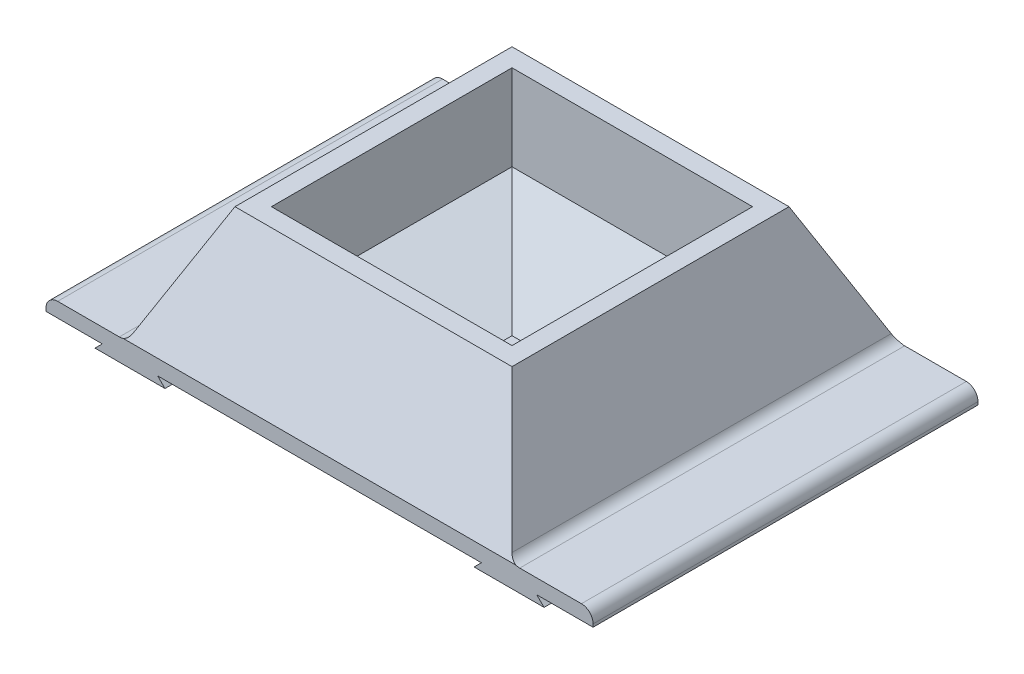
from build123d import *
from OCP.BRepFilletAPI import BRepFilletAPI_MakeChamfer

# Parameters (mm, degrees)
SKETCH1_W           = 238.252
SKETCH1_H           = 167.64
BOSS_EXTRUDE1_DEPTH = 6.35
SKETCH2_W           = 120.65
SKETCH2_H           = 120.65
SKETCH2_W_2         = 104.775
SKETCH2_H_2         = 104.775
BOSS_EXTRUDE2_DEPTH = 50.8
CHAMFER1_SIZE       = 23.622
CHAMFER1_SIZE_2     = 50.8
CHAMFER2_SIZE       = 13.462
CHAMFER2_SIZE2      = 50.240867971
BOSS_EXTRUDE3_DEPTH = 167.64
FILLET1_R           = 5.08


with BuildPart() as part:
    # Sketch1 → Boss-Extrude1 (new body)
    with BuildSketch(Plane(origin=(0, 0, 0), x_dir=(1, 0, 0), z_dir=(0, 1, 0))):
        Rectangle(SKETCH1_W, SKETCH1_H)
    extrude(amount=BOSS_EXTRUDE1_DEPTH)

    # Sketch2 → Boss-Extrude2 (add)
    with BuildSketch(Plane(origin=(0, 6.35, 0), x_dir=(1, 0, 0), z_dir=(0, 1, 0))):
        Rectangle(SKETCH2_W, SKETCH2_H)
        Rectangle(SKETCH2_W_2, SKETCH2_H_2, mode=Mode.SUBTRACT)
    extrude(amount=BOSS_EXTRUDE2_DEPTH)

    # Chamfer1
    # the kernel refuses this chamfer: 50.8, 23.622 mm, written as the material it adds along each edge
    with BuildSketch(Plane(origin=(60.325, 6.35, 60.325), x_dir=(0, -0.07505854445715336, 0.9971791287948087), z_dir=(-1, 0, 0))) as chamfer1_piece_1_section:
        Polygon((CHAMFER1_SIZE * 0.997179128795, CHAMFER1_SIZE * 0.0750585444572), (-CHAMFER1_SIZE_2 * 0.0750585444572, CHAMFER1_SIZE_2 * 0.997179128795), (0, 0), align=None)
    chamfer1_piece_1 = extrude(amount=120.65, mode=Mode.PRIVATE)
    chamfer1_piece_1 = split(chamfer1_piece_1, bisect_by=Plane(origin=(0, 23.458170977, 83.82), z_dir=(0, 0, -1)), keep=Keep.TOP, mode=Mode.PRIVATE)
    chamfer1_piece_1 = split(chamfer1_piece_1, bisect_by=Plane(origin=(0, 57.15, 67.75803998), z_dir=(0, -1, 0)), keep=Keep.TOP, mode=Mode.PRIVATE)
    add(chamfer1_piece_1)
    with BuildSketch(Plane(origin=(60.325, 6.35, -60.325), x_dir=(0.9971791287948087, -0.07505854445715335, 0), z_dir=(0, 0, 1))) as chamfer1_piece_2_section:
        Polygon((CHAMFER1_SIZE * 0.997179128795, CHAMFER1_SIZE * 0.0750585444572), (-CHAMFER1_SIZE_2 * 0.0750585444572, CHAMFER1_SIZE_2 * 0.997179128795), (0, 0), align=None)
    chamfer1_piece_2 = extrude(amount=120.65, mode=Mode.PRIVATE)
    chamfer1_piece_2 = split(chamfer1_piece_2, bisect_by=Plane(origin=(67.804180933, 57.15, 0), z_dir=(0, -1, 0)), keep=Keep.TOP, mode=Mode.PRIVATE)
    add(chamfer1_piece_2)
    with BuildSketch(Plane(origin=(-60.325, 6.35, 60.325), x_dir=(-0.9971791287948087, -0.07505854445715335, 0), z_dir=(0, 0, -1))) as chamfer1_piece_3_section:
        Polygon((CHAMFER1_SIZE * 0.997179128795, CHAMFER1_SIZE * 0.0750585444572), (-CHAMFER1_SIZE_2 * 0.0750585444572, CHAMFER1_SIZE_2 * 0.997179128795), (0, 0), align=None)
    chamfer1_piece_3 = extrude(amount=120.65, mode=Mode.PRIVATE)
    chamfer1_piece_3 = split(chamfer1_piece_3, bisect_by=Plane(origin=(-67.804180933, 57.15, 0), z_dir=(0, -1, 0)), keep=Keep.TOP, mode=Mode.PRIVATE)
    add(chamfer1_piece_3)
    with BuildSketch(Plane(origin=(-60.325, 6.35, -60.325), x_dir=(0, -0.07505854445715336, -0.9971791287948087), z_dir=(1, 0, 0))) as chamfer1_piece_4_section:
        Polygon((CHAMFER1_SIZE * 0.997179128795, CHAMFER1_SIZE * 0.0750585444572), (-CHAMFER1_SIZE_2 * 0.0750585444572, CHAMFER1_SIZE_2 * 0.997179128795), (0, 0), align=None)
    chamfer1_piece_4 = extrude(amount=120.65, mode=Mode.PRIVATE)
    chamfer1_piece_4 = split(chamfer1_piece_4, bisect_by=Plane(origin=(0, 23.458170977, -83.82), z_dir=(0, 0, 1)), keep=Keep.TOP, mode=Mode.PRIVATE)
    chamfer1_piece_4 = split(chamfer1_piece_4, bisect_by=Plane(origin=(0, 57.15, -67.75803998), z_dir=(0, -1, 0)), keep=Keep.TOP, mode=Mode.PRIVATE)
    add(chamfer1_piece_4)
    with BuildSketch(Plane(origin=(60.325, 6.35, -60.325), x_dir=(0.9971791287948087, -0.07505854445715335, 0), z_dir=(0, 0, 1))) as chamfer1_piece_5a_section:
        Polygon((CHAMFER1_SIZE * 0.997179128795, CHAMFER1_SIZE * 0.0750585444572), (-CHAMFER1_SIZE_2 * 0.0750585444572, CHAMFER1_SIZE_2 * 0.997179128795), (0, 0), align=None)
    chamfer1_piece_5a = extrude(amount=252.2737775, mode=Mode.PRIVATE)
    chamfer1_piece_5a = split(chamfer1_piece_5a, bisect_by=Plane(origin=(67.804180933, 23.405571351, 83.82), z_dir=(0, 0, -1)), keep=Keep.TOP, mode=Mode.PRIVATE)
    chamfer1_piece_5a = split(chamfer1_piece_5a, bisect_by=Plane(origin=(67.804180933, 23.405571351, 60.325), z_dir=(0, 0, 1)), keep=Keep.TOP, mode=Mode.PRIVATE)
    chamfer1_piece_5a = split(chamfer1_piece_5a, bisect_by=Plane(origin=(67.804180933, 57.15, 72.0725), z_dir=(0, -1, 0)), keep=Keep.TOP, mode=Mode.PRIVATE)
    with BuildSketch(Plane(origin=(191.9487775, 6.35, 60.325), x_dir=(0, -0.07505854445715336, 0.9971791287948087), z_dir=(-1, 0, 0))) as chamfer1_piece_5b_section:
        Polygon((CHAMFER1_SIZE * 0.997179128795, CHAMFER1_SIZE * 0.0750585444572), (-CHAMFER1_SIZE_2 * 0.0750585444572, CHAMFER1_SIZE_2 * 0.997179128795), (0, 0), align=None)
    chamfer1_piece_5b = extrude(amount=252.2737775, mode=Mode.PRIVATE)
    chamfer1_piece_5b = split(chamfer1_piece_5b, bisect_by=Plane(origin=(89.7255, 23.458170977, 83.82), z_dir=(0, 0, -1)), keep=Keep.TOP, mode=Mode.PRIVATE)
    chamfer1_piece_5b = split(chamfer1_piece_5b, bisect_by=Plane(origin=(119.126, 23.458170977, 67.75803998), z_dir=(-1, 0, 0)), keep=Keep.TOP, mode=Mode.PRIVATE)
    chamfer1_piece_5b = split(chamfer1_piece_5b, bisect_by=Plane(origin=(60.325, 23.458170977, 67.75803998), z_dir=(1, 0, 0)), keep=Keep.TOP, mode=Mode.PRIVATE)
    chamfer1_piece_5b = split(chamfer1_piece_5b, bisect_by=Plane(origin=(89.7255, 57.15, 67.75803998), z_dir=(0, -1, 0)), keep=Keep.TOP, mode=Mode.PRIVATE)
    chamfer1_piece_5 = chamfer1_piece_5a & chamfer1_piece_5b
    add(chamfer1_piece_5)
    with BuildSketch(Plane(origin=(-60.325, 6.35, 191.9487775), x_dir=(-0.9971791287948087, -0.07505854445715335, 0), z_dir=(0, 0, -1))) as chamfer1_piece_6a_section:
        Polygon((CHAMFER1_SIZE * 0.997179128795, CHAMFER1_SIZE * 0.0750585444572), (-CHAMFER1_SIZE_2 * 0.0750585444572, CHAMFER1_SIZE_2 * 0.997179128795), (0, 0), align=None)
    chamfer1_piece_6a = extrude(amount=252.2737775, mode=Mode.PRIVATE)
    chamfer1_piece_6a = split(chamfer1_piece_6a, bisect_by=Plane(origin=(-67.804180933, 23.405571351, 83.82), z_dir=(0, 0, -1)), keep=Keep.TOP, mode=Mode.PRIVATE)
    chamfer1_piece_6a = split(chamfer1_piece_6a, bisect_by=Plane(origin=(-67.804180933, 23.405571351, 60.325), z_dir=(0, 0, 1)), keep=Keep.TOP, mode=Mode.PRIVATE)
    chamfer1_piece_6a = split(chamfer1_piece_6a, bisect_by=Plane(origin=(-67.804180933, 57.15, 72.0725), z_dir=(0, -1, 0)), keep=Keep.TOP, mode=Mode.PRIVATE)
    with BuildSketch(Plane(origin=(60.325, 6.35, 60.325), x_dir=(0, -0.07505854445715336, 0.9971791287948087), z_dir=(-1, 0, 0))) as chamfer1_piece_6b_section:
        Polygon((CHAMFER1_SIZE * 0.997179128795, CHAMFER1_SIZE * 0.0750585444572), (-CHAMFER1_SIZE_2 * 0.0750585444572, CHAMFER1_SIZE_2 * 0.997179128795), (0, 0), align=None)
    chamfer1_piece_6b = extrude(amount=252.2737775, mode=Mode.PRIVATE)
    chamfer1_piece_6b = split(chamfer1_piece_6b, bisect_by=Plane(origin=(-89.7255, 23.458170977, 83.82), z_dir=(0, 0, -1)), keep=Keep.TOP, mode=Mode.PRIVATE)
    chamfer1_piece_6b = split(chamfer1_piece_6b, bisect_by=Plane(origin=(-119.126, 23.458170977, 67.75803998), z_dir=(1, 0, 0)), keep=Keep.TOP, mode=Mode.PRIVATE)
    chamfer1_piece_6b = split(chamfer1_piece_6b, bisect_by=Plane(origin=(-60.325, 23.458170977, 67.75803998), z_dir=(-1, 0, 0)), keep=Keep.TOP, mode=Mode.PRIVATE)
    chamfer1_piece_6b = split(chamfer1_piece_6b, bisect_by=Plane(origin=(-89.7255, 57.15, 67.75803998), z_dir=(0, -1, 0)), keep=Keep.TOP, mode=Mode.PRIVATE)
    chamfer1_piece_6 = chamfer1_piece_6a & chamfer1_piece_6b
    add(chamfer1_piece_6)
    with BuildSketch(Plane(origin=(60.325, 6.35, -191.9487775), x_dir=(0.9971791287948087, -0.07505854445715335, 0), z_dir=(0, 0, 1))) as chamfer1_piece_7a_section:
        Polygon((CHAMFER1_SIZE * 0.997179128795, CHAMFER1_SIZE * 0.0750585444572), (-CHAMFER1_SIZE_2 * 0.0750585444572, CHAMFER1_SIZE_2 * 0.997179128795), (0, 0), align=None)
    chamfer1_piece_7a = extrude(amount=252.2737775, mode=Mode.PRIVATE)
    chamfer1_piece_7a = split(chamfer1_piece_7a, bisect_by=Plane(origin=(67.804180933, 23.405571351, -83.82), z_dir=(0, 0, 1)), keep=Keep.TOP, mode=Mode.PRIVATE)
    chamfer1_piece_7a = split(chamfer1_piece_7a, bisect_by=Plane(origin=(67.804180933, 23.405571351, -60.325), z_dir=(0, 0, -1)), keep=Keep.TOP, mode=Mode.PRIVATE)
    chamfer1_piece_7a = split(chamfer1_piece_7a, bisect_by=Plane(origin=(67.804180933, 57.15, -72.0725), z_dir=(0, -1, 0)), keep=Keep.TOP, mode=Mode.PRIVATE)
    with BuildSketch(Plane(origin=(-60.325, 6.35, -60.325), x_dir=(0, -0.07505854445715336, -0.9971791287948087), z_dir=(1, 0, 0))) as chamfer1_piece_7b_section:
        Polygon((CHAMFER1_SIZE * 0.997179128795, CHAMFER1_SIZE * 0.0750585444572), (-CHAMFER1_SIZE_2 * 0.0750585444572, CHAMFER1_SIZE_2 * 0.997179128795), (0, 0), align=None)
    chamfer1_piece_7b = extrude(amount=252.2737775, mode=Mode.PRIVATE)
    chamfer1_piece_7b = split(chamfer1_piece_7b, bisect_by=Plane(origin=(119.126, 23.458170977, -67.75803998), z_dir=(-1, 0, 0)), keep=Keep.TOP, mode=Mode.PRIVATE)
    chamfer1_piece_7b = split(chamfer1_piece_7b, bisect_by=Plane(origin=(89.7255, 23.458170977, -83.82), z_dir=(0, 0, 1)), keep=Keep.TOP, mode=Mode.PRIVATE)
    chamfer1_piece_7b = split(chamfer1_piece_7b, bisect_by=Plane(origin=(60.325, 23.458170977, -67.75803998), z_dir=(1, 0, 0)), keep=Keep.TOP, mode=Mode.PRIVATE)
    chamfer1_piece_7b = split(chamfer1_piece_7b, bisect_by=Plane(origin=(89.7255, 57.15, -67.75803998), z_dir=(0, -1, 0)), keep=Keep.TOP, mode=Mode.PRIVATE)
    chamfer1_piece_7 = chamfer1_piece_7a & chamfer1_piece_7b
    add(chamfer1_piece_7)
    with BuildSketch(Plane(origin=(-191.9487775, 6.35, -60.325), x_dir=(0, -0.07505854445715336, -0.9971791287948087), z_dir=(1, 0, 0))) as chamfer1_piece_8a_section:
        Polygon((CHAMFER1_SIZE * 0.997179128795, CHAMFER1_SIZE * 0.0750585444572), (-CHAMFER1_SIZE_2 * 0.0750585444572, CHAMFER1_SIZE_2 * 0.997179128795), (0, 0), align=None)
    chamfer1_piece_8a = extrude(amount=252.2737775, mode=Mode.PRIVATE)
    chamfer1_piece_8a = split(chamfer1_piece_8a, bisect_by=Plane(origin=(-119.126, 23.458170977, -67.75803998), z_dir=(1, 0, 0)), keep=Keep.TOP, mode=Mode.PRIVATE)
    chamfer1_piece_8a = split(chamfer1_piece_8a, bisect_by=Plane(origin=(-89.7255, 23.458170977, -83.82), z_dir=(0, 0, 1)), keep=Keep.TOP, mode=Mode.PRIVATE)
    chamfer1_piece_8a = split(chamfer1_piece_8a, bisect_by=Plane(origin=(-60.325, 23.458170977, -67.75803998), z_dir=(-1, 0, 0)), keep=Keep.TOP, mode=Mode.PRIVATE)
    chamfer1_piece_8a = split(chamfer1_piece_8a, bisect_by=Plane(origin=(-89.7255, 57.15, -67.75803998), z_dir=(0, -1, 0)), keep=Keep.TOP, mode=Mode.PRIVATE)
    with BuildSketch(Plane(origin=(-60.325, 6.35, 60.325), x_dir=(-0.9971791287948087, -0.07505854445715335, 0), z_dir=(0, 0, -1))) as chamfer1_piece_8b_section:
        Polygon((CHAMFER1_SIZE * 0.997179128795, CHAMFER1_SIZE * 0.0750585444572), (-CHAMFER1_SIZE_2 * 0.0750585444572, CHAMFER1_SIZE_2 * 0.997179128795), (0, 0), align=None)
    chamfer1_piece_8b = extrude(amount=252.2737775, mode=Mode.PRIVATE)
    chamfer1_piece_8b = split(chamfer1_piece_8b, bisect_by=Plane(origin=(-67.804180933, 23.405571351, -83.82), z_dir=(0, 0, 1)), keep=Keep.TOP, mode=Mode.PRIVATE)
    chamfer1_piece_8b = split(chamfer1_piece_8b, bisect_by=Plane(origin=(-67.804180933, 23.405571351, -60.325), z_dir=(0, 0, -1)), keep=Keep.TOP, mode=Mode.PRIVATE)
    chamfer1_piece_8b = split(chamfer1_piece_8b, bisect_by=Plane(origin=(-67.804180933, 57.15, -72.0725), z_dir=(0, -1, 0)), keep=Keep.TOP, mode=Mode.PRIVATE)
    chamfer1_piece_8 = chamfer1_piece_8a & chamfer1_piece_8b
    add(chamfer1_piece_8)

    # Chamfer2: one chamfer whose edges measure the first distance from different faces: ONE call of the kernel's chamfer builder (chamfer() names one face for all edges)
    chamfer2_edges_1 = [part.edges().sort_by_distance(p)[0] for p in [
        (52.3875, 6.35, 0),
    ]]
    chamfer2_side_1 = [part.faces().sort_by_distance(p)[0] for p in [
        (52.3875, 31.75, 0),
    ]]
    chamfer2_edges_2 = [part.edges().sort_by_distance(p)[0] for p in [
        (0, 6.35, -52.3875),
    ]]
    chamfer2_side_2 = [part.faces().sort_by_distance(p)[0] for p in [
        (0, 31.75, -52.3875),
    ]]
    chamfer2_edges_3 = [part.edges().sort_by_distance(p)[0] for p in [
        (-52.3875, 6.35, 0),
    ]]
    chamfer2_side_3 = [part.faces().sort_by_distance(p)[0] for p in [
        (-52.3875, 31.75, 0),
    ]]
    chamfer2_edges_4 = [part.edges().sort_by_distance(p)[0] for p in [
        (0, 6.35, 52.3875),
    ]]
    chamfer2_side_4 = [part.faces().sort_by_distance(p)[0] for p in [
        (0, 31.75, 52.3875),
    ]]
    chamfer2 = BRepFilletAPI_MakeChamfer(part.part.solid().wrapped)
    for e in chamfer2_edges_1:
        chamfer2.Add(CHAMFER2_SIZE, CHAMFER2_SIZE2, e.wrapped, chamfer2_side_1[0].wrapped)  # the first distance lies on this face
    for e in chamfer2_edges_2:
        chamfer2.Add(CHAMFER2_SIZE, CHAMFER2_SIZE2, e.wrapped, chamfer2_side_2[0].wrapped)  # the first distance lies on this face
    for e in chamfer2_edges_3:
        chamfer2.Add(CHAMFER2_SIZE, CHAMFER2_SIZE2, e.wrapped, chamfer2_side_3[0].wrapped)  # the first distance lies on this face
    for e in chamfer2_edges_4:
        chamfer2.Add(CHAMFER2_SIZE, CHAMFER2_SIZE2, e.wrapped, chamfer2_side_4[0].wrapped)  # the first distance lies on this face
    add(Compound.cast(chamfer2.Shape()), mode=Mode.REPLACE)

    # Sketch3 → Boss-Extrude3 (add)
    with BuildSketch(Plane(origin=(0, 0, -83.82), x_dir=(-1, 0, 0), z_dir=(0, 0, -1))):
        Polygon((94.615, 0), (70.485, 0), (67.31, -3.175), (97.79, -3.175), align=None)
        Polygon((-67.31, -3.175), (-70.485, 0), (-94.615, 0), (-97.79, -3.175), align=None)
    extrude(amount=-BOSS_EXTRUDE3_DEPTH)

    # Fillet1
    # the kernel refuses this fillet: 5.08 mm, written as the material it adds along each edge
    with BuildSketch(Plane(origin=(-83.947, 6.35, -83.82), x_dir=(0.4216440631701671, 0.9067614261719298, 0), z_dir=(0, 0, 1))) as fillet1_piece_1_section:
        with BuildLine():
            CenterArc((FILLET1_R * 0.637825915546, FILLET1_R), FILLET1_R, 204.938427655, 65.061572345)
            Line((-FILLET1_R * 0.268935510626, FILLET1_R * 0.57835593683), (0, 0))
            Line((0, 0), (FILLET1_R * 0.637825915546, 0))
        make_face()
    fillet1_piece_1 = extrude(amount=167.64, mode=Mode.PRIVATE)
    fillet1_piece_1 = split(fillet1_piece_1, bisect_by=Plane(origin=(-84.357854202, 38.970175946, 68.778618185), z_dir=(0, -0.4216440631701673, -0.9067614261719298)), keep=Keep.TOP, mode=Mode.PRIVATE)
    fillet1_piece_1 = split(fillet1_piece_1, bisect_by=Plane(origin=(-84.357854202, 38.970175946, -68.778618185), z_dir=(0, -0.4216440631701673, 0.9067614261719298)), keep=Keep.TOP, mode=Mode.PRIVATE)
    add(fillet1_piece_1)
    with BuildSketch(Plane(origin=(83.947, 6.35, 83.82), x_dir=(-0.4216440631701671, 0.9067614261719298, 0), z_dir=(0, 0, -1))) as fillet1_piece_2_section:
        with BuildLine():
            CenterArc((FILLET1_R * 0.637825915546, FILLET1_R), FILLET1_R, 204.938427655, 65.061572345)
            Line((-FILLET1_R * 0.268935510626, FILLET1_R * 0.57835593683), (0, 0))
            Line((0, 0), (FILLET1_R * 0.637825915546, 0))
        make_face()
    fillet1_piece_2 = extrude(amount=167.64, mode=Mode.PRIVATE)
    fillet1_piece_2 = split(fillet1_piece_2, bisect_by=Plane(origin=(84.357854202, 38.970175946, 68.778618185), z_dir=(0, -0.4216440631701673, -0.9067614261719298)), keep=Keep.TOP, mode=Mode.PRIVATE)
    fillet1_piece_2 = split(fillet1_piece_2, bisect_by=Plane(origin=(84.357854202, 38.970175946, -68.778618185), z_dir=(0, -0.4216440631701673, 0.9067614261719298)), keep=Keep.TOP, mode=Mode.PRIVATE)
    add(fillet1_piece_2)
    # the kernel refuses this fillet: 5.08 mm, written as the material it takes off along each edge
    with BuildSketch(Plane(origin=(119.126, 6.35, 96.52), x_dir=(0, -1, 0), z_dir=(0, 0, -1)), Plane(origin=(-119.126, 6.35, -96.52), x_dir=(0, -1, 0), z_dir=(0, 0, 1))) as fillet1_2_piece_1:
        with BuildLine():
            CenterArc((FILLET1_R, FILLET1_R), FILLET1_R, 180, 90)
            Line((0, FILLET1_R), (0, 0))
            Line((0, 0), (FILLET1_R, 0))
        make_face()
    extrude(amount=193.04, mode=Mode.SUBTRACT)


solid = part.part
